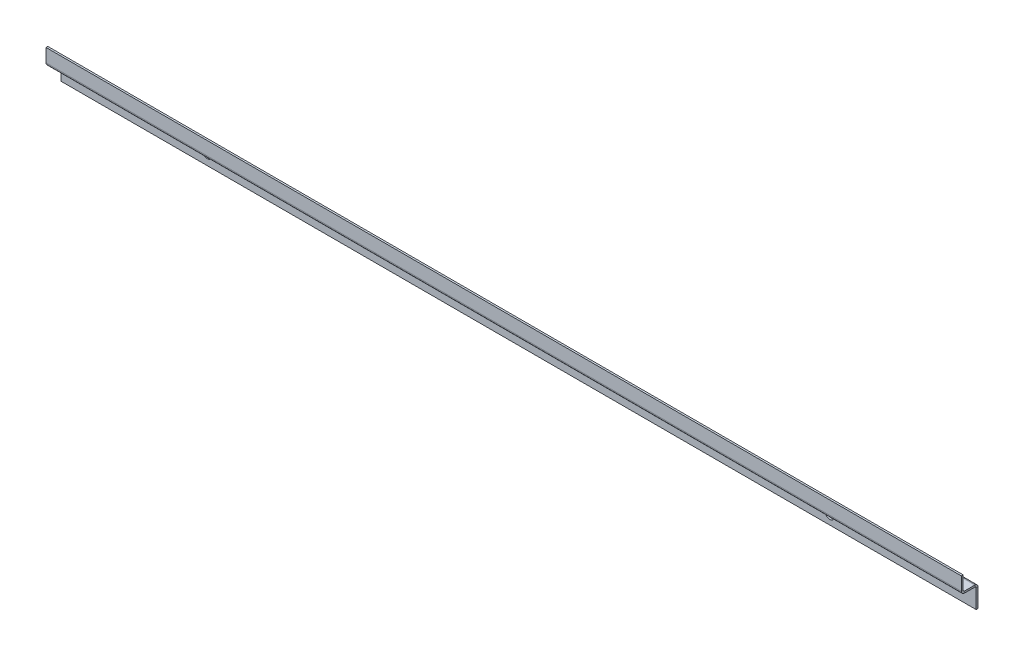
from build123d import *

# Parameters (mm, degrees)
BASE_FLANGE1_DEPTH = 500
SKETCH4_R          = 2.55
CUT_EXTRUDE1_DEPTH = 501.278732308


# Sheet-metal steps are written as plain solids
with BuildPart() as part:
    # Sketch1 → Base-Flange1 (new body)
    with BuildSketch(Plane(origin=(0, 0, 0), x_dir=(0, 0, -1), z_dir=(1, 0, 0))):
        with BuildLine():
            Line((4.05, -6), (4.05, 4.2634))
            ThreePointArc((4.05, 4.2634), (3.541361636, 5.491361636), (2.3134, 6))
            Line((2.3134, 6), (-3.3134, 6))
            ThreePointArc((-3.3134, 6), (-3.834254855, 6.215745145), (-4.05, 6.7366))
            Line((-4.05, 6.7366), (-4.05, 14))
            Line((-4.05, 14), (-5.05, 14))
            Line((-5.05, 14), (-5.05, 6.7366))
            ThreePointArc((-5.05, 6.7366), (-4.541361636, 5.508638364), (-3.3134, 5))
            Line((-3.3134, 5), (2.3134, 5))
            ThreePointArc((2.3134, 5), (2.834254855, 4.784254855), (3.05, 4.2634))
            Line((3.05, 4.2634), (3.05, -6))
            Line((3.05, -6), (4.05, -6))
        make_face()
    extrude(amount=BASE_FLANGE1_DEPTH)

    # Sketch4 → Cut-Extrude1 (cut, through all)
    with BuildSketch(Plane(origin=(0, 0, -4.05), x_dir=(-1, 0, 0), z_dir=(0, 0, -1))):
        with Locations((-420, -0.729372)):
            Circle(SKETCH4_R)
        with Locations((-80, -0.138928)):
            Circle(SKETCH4_R)
    extrude(amount=-CUT_EXTRUDE1_DEPTH, mode=Mode.SUBTRACT)


solid = part.part
